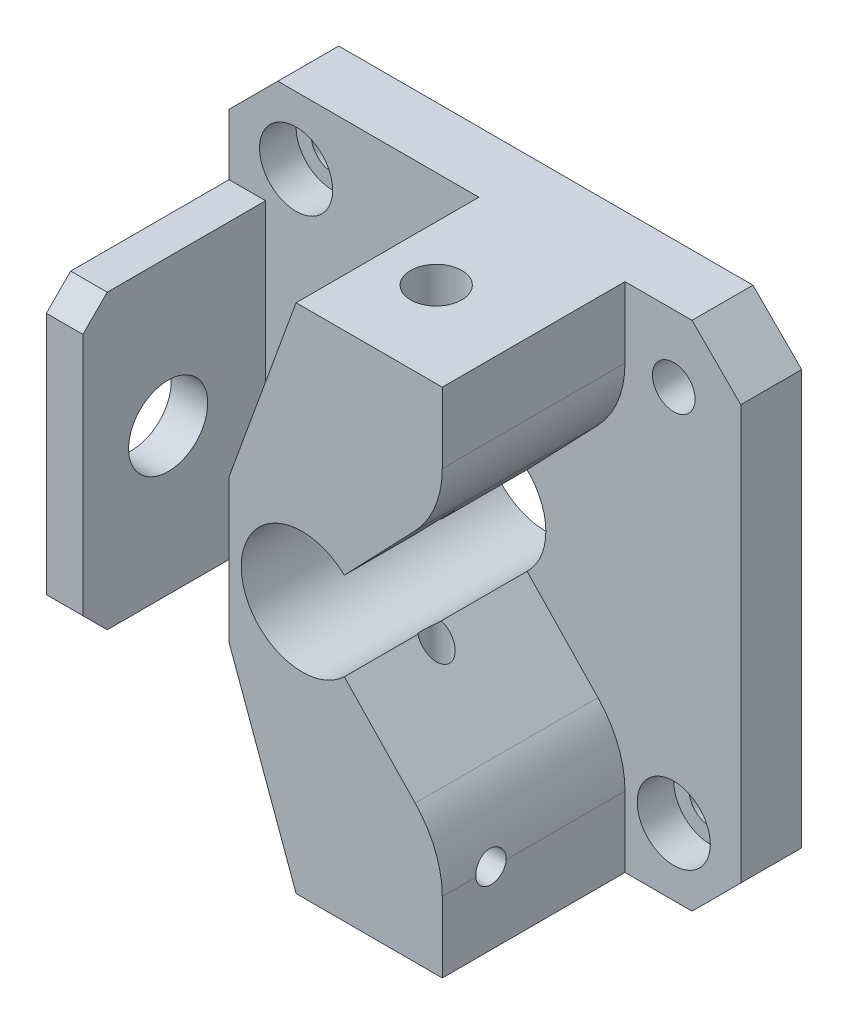
from build123d import *

# Parameters (mm, degrees)
SCHIZZO1_W                   = 42
SCHIZZO1_H                   = 42
SCHIZZO1_R                   = 1.75
ESTRUSIONE_ESTRUSIONE1_DEPTH = 5
SCHIZZO3_W                   = 17.5
SCHIZZO3_H                   = 42
ESTRUSIONE_ESTRUSIONE4_DEPTH = 15
SCHIZZO4_R                   = 5
TAGLIO_ESTRUSIONE1_DEPTH     = 36.80502758
SCHIZZO6_R                   = 1.1
TAGLIO_ESTRUSIONE3_DEPTH     = 52.039200621
TAGLIO_ESTRUSIONE4_DEPTH     = 15
RACCORDO2_R                  = 8
RACCORDO3_R                  = 8
SMUSSO1_SIZE                 = 4
FORO_FILETTATO_M3_2_D        = 2.5
FORO_FILETTATO_M3_2_DEPTH    = 12
FORO_FILETTATO_M3_2_TIP      = 0.751075774
SCHIZZO28_W                  = 3
SCHIZZO28_H                  = 24
ESTRUSIONE_ESTRUSIONE5_DEPTH = 15
SCHIZZO29_R                  = 3
TAGLIO_ESTRUSIONE6_DEPTH     = 3
SMUSSO3_SIZE2                = 15.111125807
SMUSSO3_SIZE                 = 5.5
SCHIZZO30_R                  = 3.25
TAGLIO_ESTRUSIONE7_DEPTH     = 3
SMUSSO4_SIZE                 = 2
FORO_FILETTATO_M5_1_D        = 4.2
FORO_FILETTATO_M5_1_DEPTH    = 5
FORO_FILETTATO_M5_1_TIP      = 1.2618073


with BuildPart() as part:
    # Schizzo1 → Estrusione-Estrusione1 (new body)
    with BuildSketch(Plane.XY.offset(-20)):
        Rectangle(SCHIZZO1_W, SCHIZZO1_H)
        with Locations((-15.5, 15.5)):
            Circle(SCHIZZO1_R, mode=Mode.SUBTRACT)
        with Locations((15.5, 15.5)):
            Circle(SCHIZZO1_R, mode=Mode.SUBTRACT)
        with Locations((-15.5, -15.5)):
            Circle(SCHIZZO1_R, mode=Mode.SUBTRACT)
        with Locations((15.5, -15.5)):
            Circle(SCHIZZO1_R, mode=Mode.SUBTRACT)
    extrude(amount=ESTRUSIONE_ESTRUSIONE1_DEPTH)

    # Schizzo3 → Estrusione-Estrusione4 (add)
    with BuildSketch(Plane.XY.offset(-15)):
        with Locations((2.75, 0)):
            Rectangle(SCHIZZO3_W, SCHIZZO3_H)
    extrude(amount=ESTRUSIONE_ESTRUSIONE4_DEPTH)

    # Schizzo4 → Taglio-Estrusione1 (cut, through all)
    with BuildSketch(Plane.XY):
        Circle(SCHIZZO4_R)
    extrude(amount=-TAGLIO_ESTRUSIONE1_DEPTH, mode=Mode.SUBTRACT)

    # Schizzo6 → Taglio-Estrusione3 (cut, through all)
    with BuildSketch(Plane.XZ.offset(21)):
        with Locations((4, -7)):
            Circle(SCHIZZO6_R)
    extrude(amount=-TAGLIO_ESTRUSIONE3_DEPTH, mode=Mode.SUBTRACT)

    # Schizzo7 → Taglio-Estrusione4 (cut)
    with BuildSketch(Plane.XY):
        Polygon((11.5, 12), (0, 0), (11.5, -12), align=None)
    extrude(amount=-TAGLIO_ESTRUSIONE4_DEPTH, mode=Mode.SUBTRACT)

    # Raccordo2
    raccordo2_edges = [part.edges().sort_by_distance(p)[0] for p in [
        (11.5, 12, -7.5),
    ]]
    fillet(raccordo2_edges, radius=RACCORDO2_R)

    # Raccordo3
    raccordo3_edges = [part.edges().sort_by_distance(p)[0] for p in [
        (11.5, -12, -7.5),
    ]]
    fillet(raccordo3_edges, radius=RACCORDO3_R)

    # Smusso1
    smusso1_edges = [part.edges().sort_by_distance(p)[0] for p in [
        (21, -21, -17.5),
        (-21, -21, -17.5),
        (-21, 21, -17.5),
        (21, 21, -17.5),
    ]]
    chamfer(smusso1_edges, length=SMUSSO1_SIZE)

    # Foro filettato M3-2
    with Locations(Plane(origin=(11.5, 0, 0), x_dir=(0, 0, -1), z_dir=(1, 0, 0))):
        with Locations((4, -15.111900304)):
            Hole(FORO_FILETTATO_M3_2_D / 2, depth=FORO_FILETTATO_M3_2_DEPTH)
            with Locations((0, 0, -(FORO_FILETTATO_M3_2_DEPTH + FORO_FILETTATO_M3_2_TIP / 2))):  # 118° drill point
                Cone(0, FORO_FILETTATO_M3_2_D / 2, FORO_FILETTATO_M3_2_TIP, mode=Mode.SUBTRACT)

    # Schizzo28 → Estrusione-Estrusione5 (add)
    with BuildSketch(Plane.XY.offset(-15)):
        with Locations((-19.5, 0)):
            Rectangle(SCHIZZO28_W, SCHIZZO28_H)
    extrude(amount=ESTRUSIONE_ESTRUSIONE5_DEPTH)

    # Schizzo29 → Taglio-Estrusione6 (cut)
    with BuildSketch(Plane.XY.offset(-15)):
        with Locations((-15.5, 15.5)):
            Circle(SCHIZZO29_R)
        with Locations((-15.5, -15.5)):
            Circle(SCHIZZO29_R)
        with Locations((15.5, -15.5)):
            Circle(SCHIZZO29_R)
    extrude(amount=-TAGLIO_ESTRUSIONE6_DEPTH, mode=Mode.SUBTRACT)

    # Smusso3
    smusso3_edges = [part.edges().sort_by_distance(p)[0] for p in [
        (-6, -21, -7.5),
        (-6, 21, -7.5),
    ]]
    chamfer(smusso3_edges, length=SMUSSO3_SIZE, length2=SMUSSO3_SIZE2)

    # Schizzo30 → Taglio-Estrusione7 (cut)
    with BuildSketch(Plane.ZY.offset(21)):
        with Locations((-7, 0)):
            Circle(SCHIZZO30_R)
    extrude(amount=-TAGLIO_ESTRUSIONE7_DEPTH, mode=Mode.SUBTRACT)

    # Smusso4
    smusso4_edges = [part.edges().sort_by_distance(p)[0] for p in [
        (-19.5, -12, 0),
        (-19.5, 12, 0),
    ]]
    chamfer(smusso4_edges, length=SMUSSO4_SIZE)

    # Foro filettato M5-1
    with Locations(Plane(origin=(4, 21, -7), x_dir=(1, 0, 0), z_dir=(0, 1, 0))):
        with Locations((0, 0)):
            Hole(FORO_FILETTATO_M5_1_D / 2, depth=FORO_FILETTATO_M5_1_DEPTH)
            with Locations((0, 0, -(FORO_FILETTATO_M5_1_DEPTH + FORO_FILETTATO_M5_1_TIP / 2))):  # 118° drill point
                Cone(0, FORO_FILETTATO_M5_1_D / 2, FORO_FILETTATO_M5_1_TIP, mode=Mode.SUBTRACT)


solid = part.part
